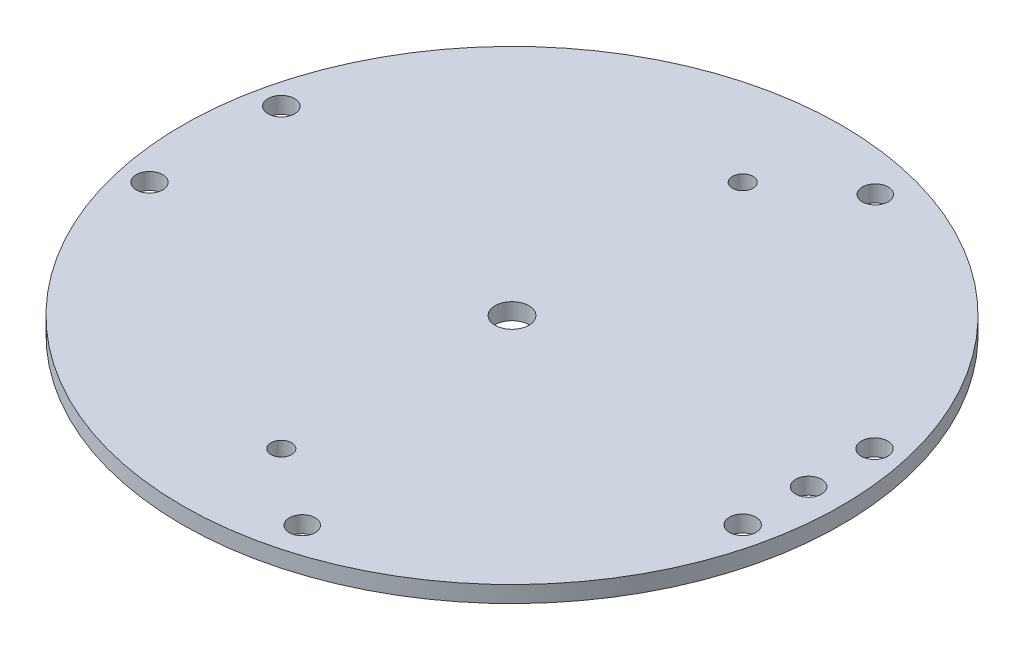
from build123d import *

# Parameters (mm, degrees)
SKETCH1_R                       = 63.5
BOSS_EXTRUDE1_DEPTH             = 3.175
F_7_0_201_DIAMETER_HOLE1_D      = 5.1054
F_9_0_196_DIAMETER_HOLE1_D      = 4.9784
F_0_257_DIAMETER_HOLE1_D        = 6.5278
F_5_32_0_15625_DIAMETER_HOLE1_D = 3.96875


with BuildPart() as part:
    # Sketch1 → Boss-Extrude1 (new body)
    with BuildSketch(Plane(origin=(0, 0, 0), x_dir=(1, 0, 0), z_dir=(0, 1, 0))):
        Circle(SKETCH1_R)
    extrude(amount=BOSS_EXTRUDE1_DEPTH)

    # #7 (0.201) Diameter Hole1 (through all)
    with Locations(Plane(origin=(0, 3.175, 0), x_dir=(1, 0, 0), z_dir=(0, 1, 0))):
        with Locations((-57.15, 12.7), (-57.15, -12.7), (57.15, 12.7), (57.15, -12.7)):
            Hole(F_7_0_201_DIAMETER_HOLE1_D / 2)

    # #9 (0.196) Diameter Hole1 (through all)
    with Locations(Plane(origin=(0, 3.175, 0), x_dir=(1, 0, 0), z_dir=(0, 1, 0))):
        with Locations((14.791508428, 55.202660972), (57.15, 0), (14.791508428, -55.202660972)):
            Hole(F_9_0_196_DIAMETER_HOLE1_D / 2)

    # F (0.257) Diameter Hole1 (through all)
    with Locations(Plane(origin=(0, 3.175, 0), x_dir=(1, 0, 0), z_dir=(0, 1, 0))):
        with Locations((0, 0)):
            Hole(F_0_257_DIAMETER_HOLE1_D / 2)

    # 5/32 (0.15625) Diameter Hole1 (through all)
    with Locations(Plane(origin=(0, 3.175, 0), x_dir=(1, 0, 0), z_dir=(0, 1, 0))):
        with Locations((0, 44.45), (0, -44.45)):
            Hole(F_5_32_0_15625_DIAMETER_HOLE1_D / 2)


solid = part.part
